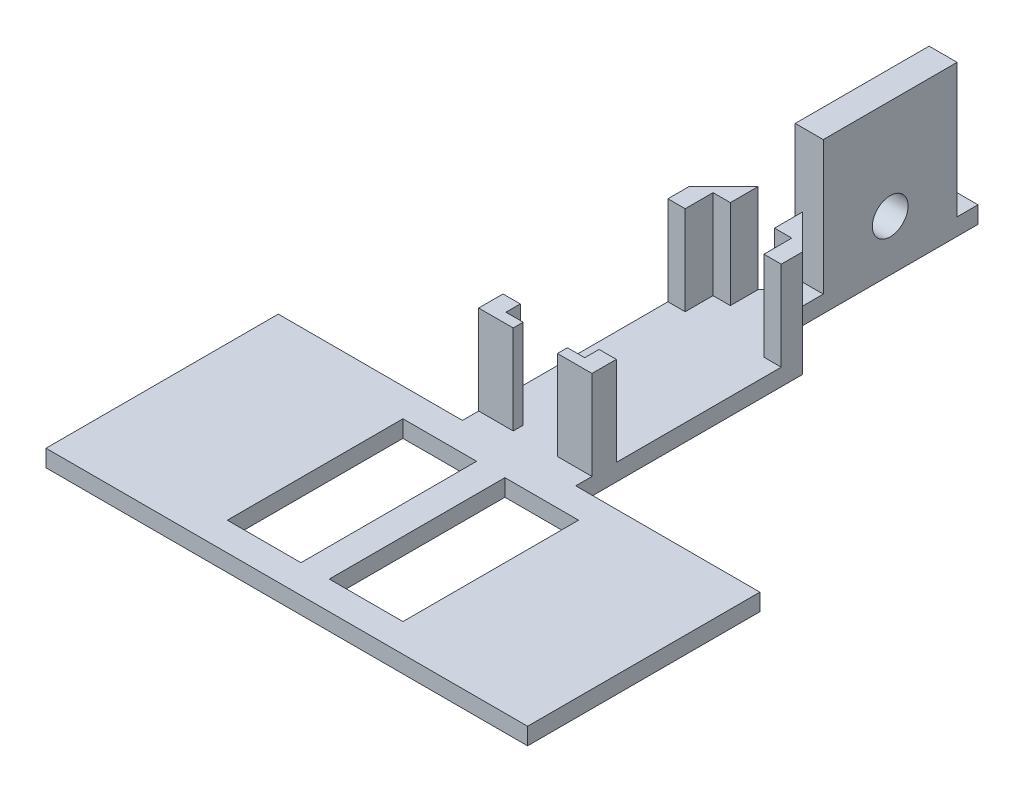
from build123d import *

# Parameters (mm, degrees)
SKETCH1_W           = 16.51
SKETCH1_H           = 39.37
BOSS_EXTRUDE1_DEPTH = 3.81
SKETCH2_W           = 6.281845558
SKETCH2_H           = 29.999999944
BOSS_EXTRUDE2_DEPTH = 30
CUT_EXTRUDE1_REACH  = 139.452
SKETCH3_R           = 4
BOSS_EXTRUDE3_DEPTH = 20


with BuildPart() as part:
    # Sketch1 → Boss-Extrude1 (new body)
    with BuildSketch(Plane(origin=(0, 0, 0), x_dir=(1, 0, 0), z_dir=(0, 1, 0))):
        Polygon((-53.975, 20.680273282), (-53.975, -31.389726718), (53.975, -31.389726718), (53.975, 20.680273282), (12.7, 20.680273282), (12.7, 71.480273282), (3.225157137, 80.955116145), (3.225157137, 120.325116145), (-3.056688421, 120.325116145), (-3.056688421, 81.123584861), (-12.7, 71.480273282), (-12.7, 20.680273282), align=None)
        with Locations((-11.43, -5.354726718)):
            Rectangle(SKETCH1_W, SKETCH1_H, mode=Mode.SUBTRACT)
        with Locations((11.43, -5.354726718)):
            Rectangle(SKETCH1_W, SKETCH1_H, mode=Mode.SUBTRACT)
    extrude(amount=BOSS_EXTRUDE1_DEPTH)

    # Sketch2 → Boss-Extrude2 (add)
    with BuildSketch(Plane(origin=(0, 3.81, 0), x_dir=(1, 0, 0), z_dir=(0, 1, 0))):
        with Locations((0.084234358, 100.640116145)):
            Rectangle(SKETCH2_W, SKETCH2_H)
    extrude(amount=BOSS_EXTRUDE2_DEPTH)

    # Sketch3 → Cut-Extrude1 (cut, up to next)
    with BuildSketch(Plane(origin=(3.225157137, 0, 0), x_dir=(0, 0, -1), z_dir=(1, 0, 0)), mode=Mode.PRIVATE) as cut_extrude1_sk1:
        with Locations((100.640116145, 11.43)):
            Circle(SKETCH3_R)
    cut_extrude1_tool1 = extrude(cut_extrude1_sk1.sketch, amount=-CUT_EXTRUDE1_REACH, mode=Mode.PRIVATE) & part.part
    add(cut_extrude1_tool1.solids().sort_by_distance((3.225157, 11.43, -100.640116))[0], mode=Mode.SUBTRACT)

    # Sketch6 → Boss-Extrude3 (add)
    with BuildSketch(Plane(origin=(0, 3.81, 0), x_dir=(1, 0, 0), z_dir=(0, 1, 0))):
        Polygon((-8.128, 24.319391954), (-4.952973996, 24.319391954), (-4.952973996, 26.561602149), (-8.829142948, 26.561602149), (-8.829142948, 29.779456866), (-12.7, 29.779456866), (-12.7, 24.319391954), align=None)
        Polygon((12.7, 24.319391954), (8.128, 24.319391954), (4.952973996, 24.319391954), (4.952973996, 26.561602149), (8.829142948, 26.561602149), (8.829142948, 29.779456866), (12.7, 29.779456866), align=None)
        Polygon((-4.952973996, 79.227299287), (-12.7, 71.480273282), (-12.7, 66.743012955), (-8.829142948, 66.743012955), (-8.829142948, 72.988681503), (-4.952973996, 72.988681503), align=None)
        Polygon((4.952973996, 72.988681503), (4.952973996, 79.227299287), (12.7, 71.480273282), (12.7, 66.743012955), (8.829142948, 66.743012955), (8.829142948, 72.988681503), align=None)
    extrude(amount=BOSS_EXTRUDE3_DEPTH)


solid = part.part
